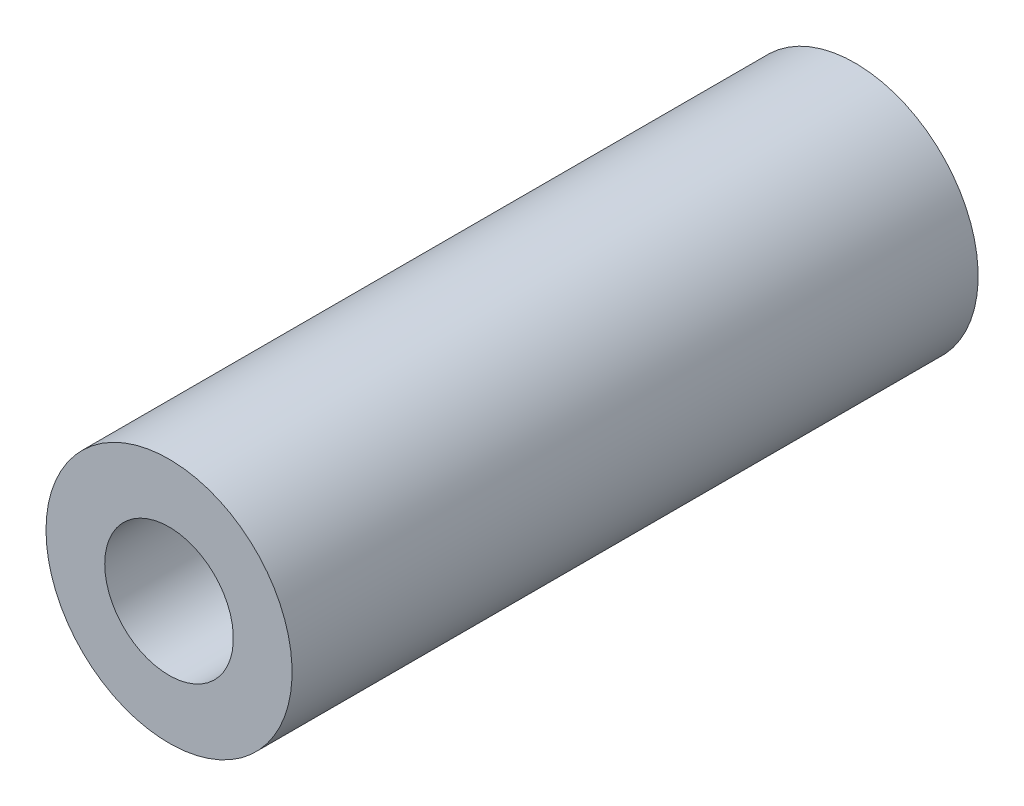
from build123d import *

# Parameters (mm, degrees)
SKETCH1_R           = 4.7625
SKETCH1_R_2         = 2.4892
BOSS_EXTRUDE1_DEPTH = 26.5557


with BuildPart() as part:
    # Sketch1 → Boss-Extrude1 (new body)
    with BuildSketch(Plane.XY):
        Circle(SKETCH1_R)
        Circle(SKETCH1_R_2, mode=Mode.SUBTRACT)
    extrude(amount=BOSS_EXTRUDE1_DEPTH)


solid = part.part
